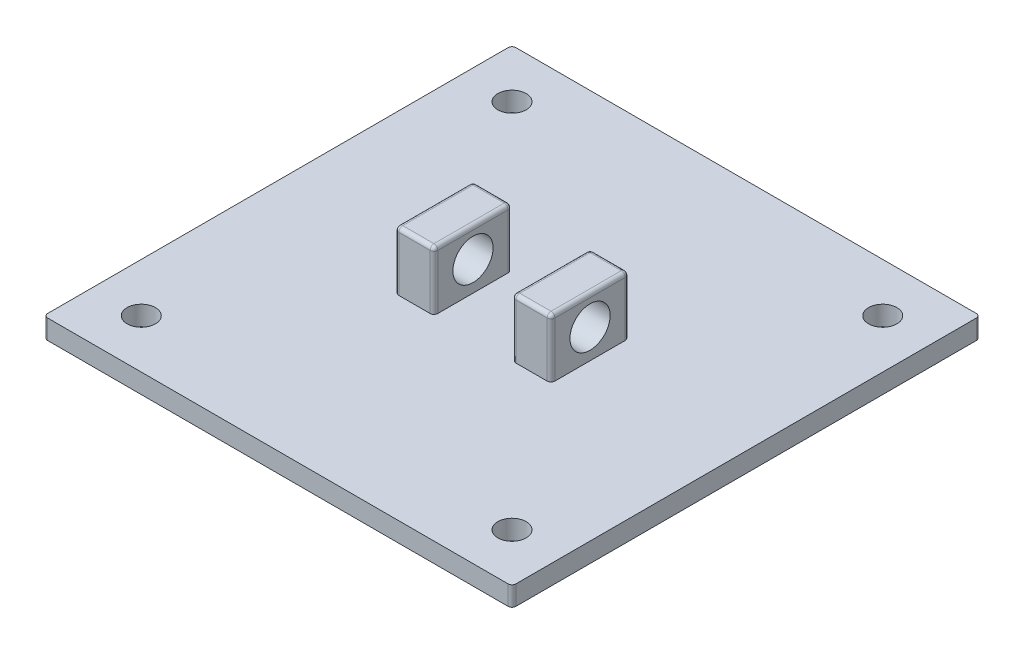
from build123d import *

# Parameters (mm, degrees)
ESQUISSE1_W             = 240
ESQUISSE1_H             = 240
BOSS_EXTRU_1_DEPTH      = 10
ESQUISSE2_R             = 7.25
ENL_V_MAT_EXTRU_1_DEPTH = 10
ESQUISSE5_W             = 20
ESQUISSE5_H             = 40
BOSS_EXTRU_5_DEPTH      = 30
ESQUISSE7_R             = 10.3
ENL_V_MAT_EXTRU_2_DEPTH = 80
CONG_1_R                = 2
CONG_2_R                = 2
CONG_3_R                = 2
CONG_4_R                = 2
CONG_5_R                = 2
CONG_6_R                = 2
CONG_7_R                = 2
CONG_8_R                = 2
CONG_9_R                = 2
CONG_10_R               = 2
CONG_11_R               = 2
CONG_12_R               = 2


with BuildPart() as part:
    # Esquisse1 → Boss.-Extru.1 (new body)
    with BuildSketch(Plane(origin=(0, 0, 0), x_dir=(1, 0, 0), z_dir=(0, 1, 0))):
        Rectangle(ESQUISSE1_W, ESQUISSE1_H)
    extrude(amount=BOSS_EXTRU_1_DEPTH)

    # Esquisse2 → Enlèv. mat.-Extru.1 (cut)
    with BuildSketch(Plane(origin=(0, 10, 0), x_dir=(1, 0, 0), z_dir=(0, 1, 0))):
        with Locations((-95, -95)):
            Circle(ESQUISSE2_R)
        with Locations((-95, 95)):
            Circle(ESQUISSE2_R)
        with Locations((95, 95)):
            Circle(ESQUISSE2_R)
        with Locations((95, -95)):
            Circle(ESQUISSE2_R)
    extrude(amount=-ENL_V_MAT_EXTRU_1_DEPTH, mode=Mode.SUBTRACT)

    # Esquisse5 → Boss.-Extru.5 (add)
    with BuildSketch(Plane(origin=(0, 10, 0), x_dir=(1, 0, 0), z_dir=(0, 1, 0))):
        with Locations((-30, 0)):
            Rectangle(ESQUISSE5_W, ESQUISSE5_H)
        with Locations((30, 0)):
            Rectangle(ESQUISSE5_W, ESQUISSE5_H)
    extrude(amount=BOSS_EXTRU_5_DEPTH)

    # Esquisse7 → Enlèv. mat.-Extru.2 (cut)
    with BuildSketch(Plane.ZY.offset(40)):
        with Locations((0, 25)):
            Circle(ESQUISSE7_R)
    extrude(amount=-ENL_V_MAT_EXTRU_2_DEPTH, mode=Mode.SUBTRACT)

    # Congé1
    cong_1_edges = [part.edges().sort_by_distance(p)[0] for p in [
        (-120, 5, -120),
    ]]
    fillet(cong_1_edges, radius=CONG_1_R)

    # Congé2
    cong_2_edges = [part.edges().sort_by_distance(p)[0] for p in [
        (-120, 5, 120),
    ]]
    fillet(cong_2_edges, radius=CONG_2_R)

    # Congé3
    cong_3_edges = [part.edges().sort_by_distance(p)[0] for p in [
        (120, 5, 120),
    ]]
    fillet(cong_3_edges, radius=CONG_3_R)

    # Congé4
    cong_4_edges = [part.edges().sort_by_distance(p)[0] for p in [
        (120, 5, -120),
    ]]
    fillet(cong_4_edges, radius=CONG_4_R)

    # Congé5
    cong_5_edges = [part.edges().sort_by_distance(p)[0] for p in [
        (30, 40, -20),
    ]]
    fillet(cong_5_edges, radius=CONG_5_R)

    # Congé6
    cong_6_edges = [part.edges().sort_by_distance(p)[0] for p in [
        (30, 40, 20),
    ]]
    fillet(cong_6_edges, radius=CONG_6_R)

    # Congé7
    cong_7_edges = [part.edges().sort_by_distance(p)[0] for p in [
        (40, 24, 20),
        (40, 39.414213562, 19.414213562),
        (40, 24, -20),
        (40, 39.414213562, -19.414213562),
        (40, 40, 0),
    ]]
    fillet(cong_7_edges, radius=CONG_7_R)

    # Congé8
    cong_8_edges = [part.edges().sort_by_distance(p)[0] for p in [
        (-20, 40, 0),
    ]]
    fillet(cong_8_edges, radius=CONG_8_R)

    # Congé9
    cong_9_edges = [part.edges().sort_by_distance(p)[0] for p in [
        (-20, 24, 20),
        (-20.585786438, 39.414213562, 20),
        (-31, 40, 20),
    ]]
    fillet(cong_9_edges, radius=CONG_9_R)

    # Congé10
    cong_10_edges = [part.edges().sort_by_distance(p)[0] for p in [
        (-40, 24, 20),
        (-40, 39.414213562, 19.414213562),
        (-40, 40, -1),
    ]]
    fillet(cong_10_edges, radius=CONG_10_R)

    # Congé11
    cong_11_edges = [part.edges().sort_by_distance(p)[0] for p in [
        (-20, 24, -20),
        (-20.585786438, 39.414213562, -20),
        (-40, 24, -20),
        (-39.414213562, 39.414213562, -20),
        (-30, 40, -20),
    ]]
    fillet(cong_11_edges, radius=CONG_11_R)

    # Congé12
    cong_12_edges = [part.edges().sort_by_distance(p)[0] for p in [
        (20, 24, -20),
        (20, 39.414213562, -19.414213562),
        (20, 24, 20),
        (20, 39.414213562, 19.414213562),
        (20, 40, 0),
    ]]
    fillet(cong_12_edges, radius=CONG_12_R)


solid = part.part
